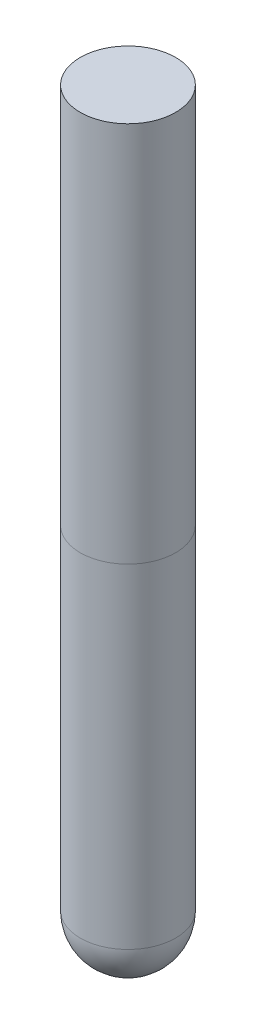
from build123d import *

# Parameters (mm, degrees)
SKETCH3_R           = 3.175
BOSS_EXTRUDE1_DEPTH = 25.4


with BuildPart() as part:
    # Sketch1 → Revolve1 (revolve)
    with BuildSketch(Plane.XY):
        with BuildLine():
            Line((0, 0), (3.175, 0))
            Line((3.175, 0), (3.175, -22.225))
            ThreePointArc((3.175, -22.225), (2.24506403, -24.47006403), (0, -25.4))
            Line((0, -25.4), (0, 0))
        make_face()
    revolve(axis=Axis((0, 0, 0), (0, -1, 0)))

    # Sketch3 → Boss-Extrude1 (add)
    with BuildSketch(Plane(origin=(0, 0, 0), x_dir=(1, 0, 0), z_dir=(0, 1, 0))):
        Circle(SKETCH3_R)
    extrude(amount=BOSS_EXTRUDE1_DEPTH)


with BuildPart() as body_2:
    # Split1: the piece on the far side of the plane
    add(part.part)
    split(bisect_by=Plane.ZX, keep=Keep.BOTTOM)


with BuildPart() as part_1:
    add(part.part)

    # Split1
    split(bisect_by=Plane.ZX, keep=Keep.TOP)


solid = Compound([body_2.part, part_1.part])
